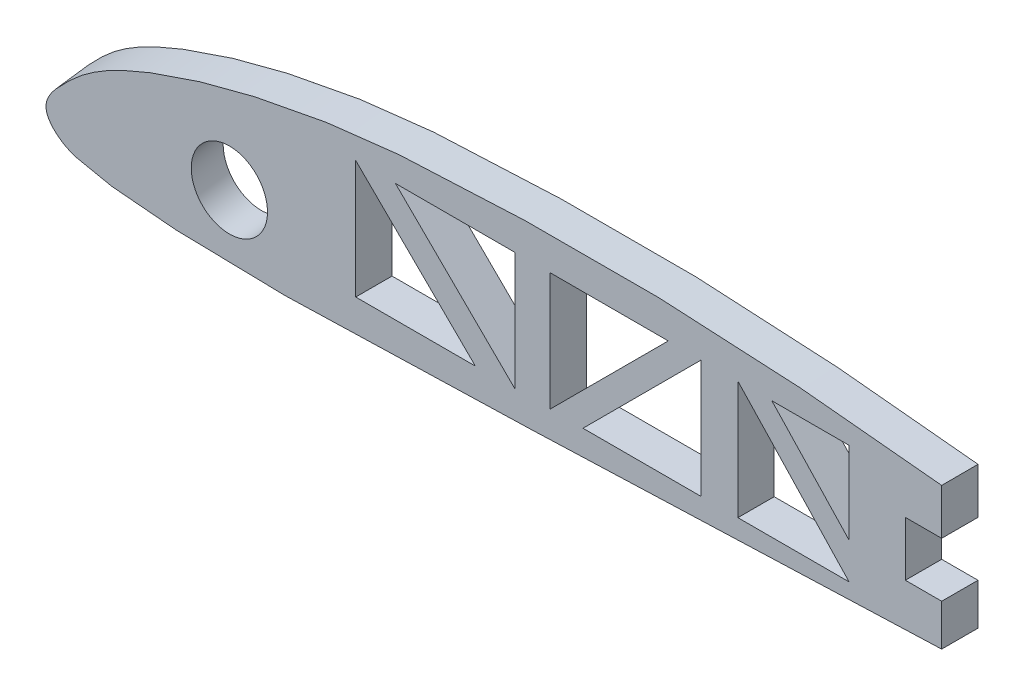
from build123d import *

# Parameters (mm, degrees)
SKETCH_3_W          = 2
SKETCH_3_H          = 3
CUT_EXTRUDE_1_DEPTH = 10
CUT_EXTRUDE_2_DEPTH = 10
SKETCH_6_R          = 2.1


with BuildPart() as part:
    # 边界2: read off the stored shape, not the designer's step
    # 边界2: loft between two sections, ruled curve by curve
    other_2_from = [
        Edge.make_bspline([(114.533260922, -0.06366524, 2), (112.746692781, -0.129287047, 2), (109.17352805, -0.26049572, 2), (103.813810865, -0.457339787, 2), (98.454078208, -0.654168455, 2), (93.98764258, -0.818206692, 2), (90.414489814, -0.949425208, 2), (87.73462772, -1.047859215, 2), (85.054764898, -1.146304149, 2), (82.374901475, -1.244715892, 2), (79.695035291, -1.343061006, 2), (77.015169315, -1.441407149, 2), (74.335304864, -1.539797498, 2), (71.655449281, -1.638427594, 2), (68.975599109, -1.737205488, 2), (66.295739559, -1.835728052, 2), (63.615853413, -1.933526742, 2), (60.935939791, -2.030565279, 2), (58.256055892, -2.128430699, 2), (55.576259237, -2.228652971, 2), (53.343194304, -2.314797002, 2), (51.55659006, -2.37965356, 2), (50.216525967, -2.425157113, 2), (48.876314114, -2.466101198, 2), (47.535936449, -2.501294105, 2), (46.195391212, -2.529371632, 2), (44.85468426, -2.54871704, 2), (43.51386811, -2.55725176, 2), (42.173015315, -2.553722487, 2), (40.83229322, -2.535159563, 2), (39.491838937, -2.50200854, 2), (38.152051023, -2.447665809, 2), (36.812966016, -2.380068892, 2), (35.697834091, -2.306465033, 2), (34.809156447, -2.208524944, 2), (34.145384076, -2.11347133, 2), (33.486325706, -1.990201215, 2), (32.828436799, -1.861106021, 2), (32.174772193, -1.710755152, 2), (31.654182451, -1.497914632, 2), (31.281287992, -1.249506318, 2), (31.025588521, -1.031832967, 2), (30.803070831, -0.779723831, 2), (30.629330896, -0.490788157, 2), (30.546149199, -0.159929095, 2), (30.596378147, 0.177280919, 2), (30.736358234, 0.483537541, 2), (30.921754988, 0.763600877, 2), (31.134734, 1.022817817, 2), (31.363099633, 1.268291915, 2), (31.599478896, 1.506008317, 2), (31.838764072, 1.740751562, 2), (32.083322231, 1.97007162, 2), (32.41954774, 2.264641767, 2), (32.860822064, 2.607998307, 2), (33.419208703, 2.979743499, 2), (33.999742095, 3.315582042, 2), (34.595168942, 3.623987318, 2), (35.202828357, 3.907518995, 2), (35.819540776, 4.170596392, 2), (36.443086351, 4.417028415, 2), (37.072053924, 4.649188901, 2), (37.704933803, 4.870446613, 2), (38.341297203, 5.081463259, 2), (39.194425148, 5.348447541, 2), (40.269097273, 5.654886792, 2), (41.569182609, 5.983488248, 2), (42.877475165, 6.277569339, 2), (44.192450237, 6.540134557, 2), (45.513340285, 6.771098594, 2), (46.839536903, 6.969441093, 2), (48.614040203, 7.18814998, 2), (50.840586428, 7.384759673, 2), (53.518582658, 7.529290807, 2), (56.198864014, 7.618011783, 2), (58.879992537, 7.674274963, 2), (61.561754503, 7.686307173, 2), (64.243287536, 7.6487468, 2), (66.923464058, 7.554890408, 2), (69.601411988, 7.411956926, 2), (72.276634435, 7.224859268, 2), (74.948880687, 6.999542133, 2), (77.617664121, 6.736166926, 2), (80.282456898, 6.435261837, 2), (82.942785438, 6.097016561, 2), (85.598523375, 5.72475958, 2), (89.133751849, 5.188711114, 2), (93.542681042, 4.454782958, 2), (98.817122816, 3.480882796, 2), (104.073392369, 2.413945131, 2), (109.313938856, 1.271851124, 2), (112.793699597, 0.449341833, 2), (114.56400942, 0.029680717, 2), (114.625153048, 0.015186303, 2), (114.717045174, -0.006597201, 2), (114.8089373, -0.028380706, 2), (114.870198717, -0.042903042, 2), (114.900829426, -0.05016421, 2)], [0, 0, 0, 0, 0.031181105, 0.062362211, 0.093543316, 0.124724421, 0.140314974, 0.155905527, 0.171496079, 0.187086632, 0.202677185, 0.218267737, 0.23385829, 0.249448843, 0.265039395, 0.280629948, 0.296220501, 0.311811053, 0.327401606, 0.342992159, 0.358582711, 0.366377988, 0.374173264, 0.38196854, 0.389763817, 0.397559093, 0.405354369, 0.413149646, 0.420944922, 0.428740198, 0.436535474, 0.444330751, 0.452126027, 0.459921303, 0.463818942, 0.46771658, 0.471614218, 0.475511856, 0.479409494, 0.483307132, 0.485255952, 0.487204771, 0.48915359, 0.491102409, 0.493051228, 0.495000047, 0.496948866, 0.498897685, 0.500846504, 0.502795323, 0.504744142, 0.506692961, 0.508641781, 0.5105906, 0.514488238, 0.518385876, 0.522283514, 0.526181152, 0.53007879, 0.533976429, 0.537874067, 0.541771705, 0.545669343, 0.549566981, 0.553464619, 0.561259896, 0.569055172, 0.576850448, 0.584645725, 0.592441001, 0.600236277, 0.608031554, 0.623622106, 0.639212659, 0.654803212, 0.670393764, 0.685984317, 0.70157487, 0.717165422, 0.732755975, 0.748346528, 0.76393708, 0.779527633, 0.795118186, 0.810708738, 0.826299291, 0.841889844, 0.873070949, 0.904252054, 0.93543316, 0.966614265, 0.99779537, 0.99779537, 0.998346528, 0.998897685, 0.999448843, 1, 1, 1, 1], 3),
        Edge.make_line((114.900829426, -0.05016421, 2), (114.533260922, -0.06366524, 2)),
    ]
    other_2_to = [
        Edge.make_bspline([(114.532211623, -0.063703781, 0), (112.740543363, -0.129512919, 0), (109.157178222, -0.261096159, 0), (103.782160602, -0.458502152, 0), (98.407127419, -0.655892727, 0), (93.927941399, -0.820399214, 0), (90.344588299, -0.951992373, 0), (87.65707596, -1.050707273, 0), (84.969562904, -1.149433536, 0), (82.282049197, -1.248125276, 0), (79.594532939, -1.346755891, 0), (76.907016453, -1.445375913, 0), (74.219501785, -1.544047975, 0), (71.531996338, -1.642969408, 0), (68.844495543, -1.742018041, 0), (66.156985961, -1.840827354, 0), (63.469449387, -1.938902047, 0), (60.781885441, -2.036219395, 0), (58.094351201, -2.134363205, 0), (55.406904511, -2.234872151, 0), (53.167464802, -2.321261771, 0), (51.375760319, -2.386303638, 0), (50.031870721, -2.431937009, 0), (48.687832947, -2.472998017, 0), (47.343628885, -2.508291363, 0), (45.999256774, -2.536449051, 0), (44.654722486, -2.555849672, 0), (43.310078687, -2.564408751, 0), (41.965398139, -2.560869392, 0), (40.620848666, -2.542253466, 0), (39.276567768, -2.509007795, 0), (37.932955142, -2.454509915, 0), (36.590047429, -2.386720024, 0), (35.471732122, -2.312906017, 0), (34.580517561, -2.214686292, 0), (33.914850315, -2.119361291, 0), (33.253910527, -1.995739238, 0), (32.594143535, -1.866275521, 0), (31.938612921, -1.715495346, 0), (31.416537114, -1.50204704, 0), (31.042578255, -1.252929432, 0), (30.786148914, -1.034634592, 0), (30.562996134, -0.781805636, 0), (30.388760416, -0.492045006, 0), (30.305341658, -0.160241324, 0), (30.355714397, 0.177931257, 0), (30.496094278, 0.485062056, 0), (30.682020408, 0.765924815, 0), (30.895607477, 1.025881689, 0), (31.12462507, 1.272056509, 0), (31.361679141, 1.510451511, 0), (31.60164742, 1.745864868, 0), (31.846903744, 1.975839546, 0), (32.18408912, 2.271250563, 0), (32.6266232, 2.615587233, 0), (33.186603918, 2.988393583, 0), (33.768794598, 3.325190797, 0), (34.365921242, 3.634476438, 0), (34.97531537, 3.918817476, 0), (35.593788341, 4.182645854, 0), (36.219113971, 4.429781341, 0), (36.849877076, 4.662604559, 0), (37.484563653, 4.884493876, 0), (38.122743695, 5.096112904, 0), (38.978307086, 5.363859307, 0), (40.056047101, 5.671173356, 0), (41.359843821, 6.000712783, 0), (42.671871182, 6.295633464, 0), (43.990600147, 6.558948013, 0), (45.31526095, 6.790571701, 0), (46.645243514, 6.989479765, 0), (48.424812468, 7.208814147, 0), (50.65771493, 7.405983079, 0), (53.34335617, 7.550926488, 0), (56.031288785, 7.639903092, 0), (58.720071332, 7.696325539, 0), (61.409488763, 7.708392545, 0), (64.098677123, 7.670725144, 0), (66.786504227, 7.576599759, 0), (69.472097957, 7.433260457, 0), (72.154955482, 7.245624308, 0), (74.834833931, 7.019672136, 0), (77.511227853, 6.755523944, 0), (80.183639644, 6.453810733, 0), (82.851544405, 6.114513872, 0), (85.514886995, 5.741301325, 0), (89.060182415, 5.203615565, 0), (93.481717133, 4.467676122, 0), (98.771204494, 3.490945738, 0), (104.04248523, 2.420988637, 0), (109.297988746, 1.275620209, 0), (112.787684369, 0.450767774, 0), (114.563047899, 0.029908651, 0), (114.624366074, 0.01537286, 0), (114.716520525, -0.00647283, 0), (114.808674975, -0.02831852, 0), (114.870111276, -0.042882314, 0), (114.900829426, -0.05016421, 0)], [0, 0, 0, 0, 0.031181105, 0.062362211, 0.093543316, 0.124724421, 0.140314974, 0.155905527, 0.171496079, 0.187086632, 0.202677185, 0.218267737, 0.23385829, 0.249448843, 0.265039395, 0.280629948, 0.296220501, 0.311811053, 0.327401606, 0.342992159, 0.358582711, 0.366377988, 0.374173264, 0.38196854, 0.389763817, 0.397559093, 0.405354369, 0.413149646, 0.420944922, 0.428740198, 0.436535474, 0.444330751, 0.452126027, 0.459921303, 0.463818942, 0.46771658, 0.471614218, 0.475511856, 0.479409494, 0.483307132, 0.485255952, 0.487204771, 0.48915359, 0.491102409, 0.493051228, 0.495000047, 0.496948866, 0.498897685, 0.500846504, 0.502795323, 0.504744142, 0.506692961, 0.508641781, 0.5105906, 0.514488238, 0.518385876, 0.522283514, 0.526181152, 0.53007879, 0.533976429, 0.537874067, 0.541771705, 0.545669343, 0.549566981, 0.553464619, 0.561259896, 0.569055172, 0.576850448, 0.584645725, 0.592441001, 0.600236277, 0.608031554, 0.623622106, 0.639212659, 0.654803212, 0.670393764, 0.685984317, 0.70157487, 0.717165422, 0.732755975, 0.748346528, 0.76393708, 0.779527633, 0.795118186, 0.810708738, 0.826299291, 0.841889844, 0.873070949, 0.904252054, 0.93543316, 0.966614265, 0.99779537, 0.99779537, 0.998346528, 0.998897685, 0.999448843, 1, 1, 1, 1], 3),
        Edge.make_line((114.900829426, -0.05016421, 0), (114.532211623, -0.063703781, 0)),
    ]
    other_2 = Solid(Shell([*[Face.make_surface_from_curves(other_2_from[k], other_2_to[k]) for k in range(2)], Face(Wire(other_2_from)), Face(Wire(other_2_to))]))
    add(other_2)

    # 草图3 → 切除-拉伸1 (cut)
    with BuildSketch(Plane(origin=(0, 0, 0), x_dir=(-1, 0, 0), z_dir=(0, 0, -1))):
        with BuildLine():
            Line((-114.532211623, -0.063703781), (-114.900829426, -0.05016421))
            add(Edge.make_bspline(
                [(-79.900829426, 6.481190313), (-79.99485742, 6.470045687), (-80.979009237, 6.352657794), (-82.851544405, 6.114513872), (-85.514886995, 5.741301325), (-89.060182415, 5.203615565), (-93.481717133, 4.467676122), (-98.771204494, 3.490945738), (-104.04248523, 2.420988637), (-109.297988746, 1.275620209), (-112.787684369, 0.450767774), (-114.563047899, 0.029908651), (-114.624366074, 0.01537286), (-114.716520525, -0.00647283), (-114.808674975, -0.02831852), (-114.870111276, -0.042882314), (-114.900829426, -0.05016421)],
                knots=[0.793471442, 0.793471442, 0.793471442, 0.793471442, 0.795118186, 0.810708738, 0.826299291, 0.841889844, 0.873070949, 0.904252054, 0.93543316, 0.966614265, 0.99779537, 0.99779537, 0.998346528, 0.998897685, 0.999448843, 1, 1, 1, 1], degree=3))
            Line((-79.900829426, 6.481190313), (-79.900829426, 17.650637701))
            Line((-79.900829426, 17.650637701), (-118.699404688, 17.650637701))
            Line((-118.699404688, 17.650637701), (-118.699404688, -9.509133985))
            Line((-118.699404688, -9.509133985), (-79.900829426, -9.509133985))
            Line((-79.900829426, -9.509133985), (-79.900829426, -1.335513706))
            add(Edge.make_bspline(
                [(-114.532211623, -0.063703781), (-112.740543363, -0.129512919), (-109.157178222, -0.261096159), (-103.782160602, -0.458502152), (-98.407127419, -0.655892727), (-93.927941399, -0.820399214), (-90.344588299, -0.951992373), (-87.65707596, -1.050707273), (-84.969562904, -1.149433536), (-82.384147938, -1.244375973), (-80.694569362, -1.306384926), (-79.900829426, -1.335513706)],
                knots=[0, 0, 0, 0, 0.031181105, 0.062362211, 0.093543316, 0.124724421, 0.140314974, 0.155905527, 0.171496079, 0.187086632, 0.200900328, 0.200900328, 0.200900328, 0.200900328], degree=3))
        make_face()
        with BuildLine():
            add(Edge.make_bspline(
                [(-79.900829426, 6.481190313), (-79.99485742, 6.470045687), (-80.979009237, 6.352657794), (-82.851544405, 6.114513872), (-85.514886995, 5.741301325), (-89.060182415, 5.203615565), (-93.481717133, 4.467676122), (-98.771204494, 3.490945738), (-104.04248523, 2.420988637), (-109.297988746, 1.275620209), (-112.787684369, 0.450767774), (-114.563047899, 0.029908651), (-114.624366074, 0.01537286), (-114.716520525, -0.00647283), (-114.808674975, -0.02831852), (-114.870111276, -0.042882314), (-114.900829426, -0.05016421)],
                knots=[0.793471442, 0.793471442, 0.793471442, 0.793471442, 0.795118186, 0.810708738, 0.826299291, 0.841889844, 0.873070949, 0.904252054, 0.93543316, 0.966614265, 0.99779537, 0.99779537, 0.998346528, 0.998897685, 0.999448843, 1, 1, 1, 1], degree=3))
            Line((-114.900829426, -0.05016421), (-79.900829426, -0.05016421))
            Line((-79.900829426, -0.05016421), (-79.900829426, 0.94983579))
            Line((-79.900829426, 0.94983579), (-79.900829426, 3.94983579))
            Line((-79.900829426, 3.94983579), (-79.900829426, 6.481190313))
        make_face()
        with BuildLine():
            Line((-79.900829426, -0.05016421), (-114.900829426, -0.05016421))
            Line((-114.900829426, -0.05016421), (-114.532211623, -0.063703781))
            add(Edge.make_bspline(
                [(-114.532211623, -0.063703781), (-112.740543363, -0.129512919), (-109.157178222, -0.261096159), (-103.782160602, -0.458502152), (-98.407127419, -0.655892727), (-93.927941399, -0.820399214), (-90.344588299, -0.951992373), (-87.65707596, -1.050707273), (-84.969562904, -1.149433536), (-82.384147938, -1.244375973), (-80.694569362, -1.306384926), (-79.900829426, -1.335513706)],
                knots=[0, 0, 0, 0, 0.031181105, 0.062362211, 0.093543316, 0.124724421, 0.140314974, 0.155905527, 0.171496079, 0.187086632, 0.200900328, 0.200900328, 0.200900328, 0.200900328], degree=3))
            Line((-79.900829426, -1.335513706), (-79.900829426, -0.05016421))
        make_face()
        with Locations((-78.900829426, 2.44983579)):
            Rectangle(SKETCH_3_W, SKETCH_3_H)
    extrude(amount=-CUT_EXTRUDE_1_DEPTH, mode=Mode.SUBTRACT)

    # 草图4 → 切除-拉伸2 (cut)
    with BuildSketch(Plane(origin=(0, 0, 0), x_dir=(-1, 0, 0), z_dir=(0, 0, -1))):
        Polygon((-47.627162672, 5.836417076), (-47.627162672, -0.67716775), (-54.217377907, -0.67716775), align=None)
        Polygon((-49.811129349, 5.836417076), (-56.401344584, -0.67716775), (-56.401344584, 5.836417076), (-50.079335783, 5.836417076), align=None)
        Polygon((-58.327461908, 5.836417076), (-58.327461908, -0.67716775), (-64.841046735, 5.836417076), (-58.53708415, 5.836417076), align=None)
        Polygon((-66.657408142, 5.836417076), (-60.143823316, -0.67716775), (-66.657408142, -0.67716775), align=None)
        Polygon((-68.675882644, 5.836417076), (-68.675882644, -0.67716775), (-74.80090872, -0.67716775), align=None)
        Polygon((-74.80090872, 1.311166983), (-70.545606062, 5.836417076), (-74.80090872, 5.836417076), align=None)
    extrude(amount=-CUT_EXTRUDE_2_DEPTH, mode=Mode.SUBTRACT)

    # 切除-扫描1: sweep along a path in 草图7
    with BuildLine(Plane(origin=(114.900829426, -0.05016421, -252), x_dir=(1, 0, 0), z_dir=(0, 1, 0))) as sweep_1_path:
        Line((-200, 0), (-160.4, -329))
    # 草图6 → 切除-扫描1 (sweep, cut)
    with BuildSketch(Plane(origin=(114.900829426, -0.05016421, -252), x_dir=(-1, 0, 0), z_dir=(0, 0, -1))):
        with Locations((104.805246224, 1)):
            Circle(SKETCH_6_R)
    sweep(path=sweep_1_path.line, mode=Mode.SUBTRACT)


solid = part.part
